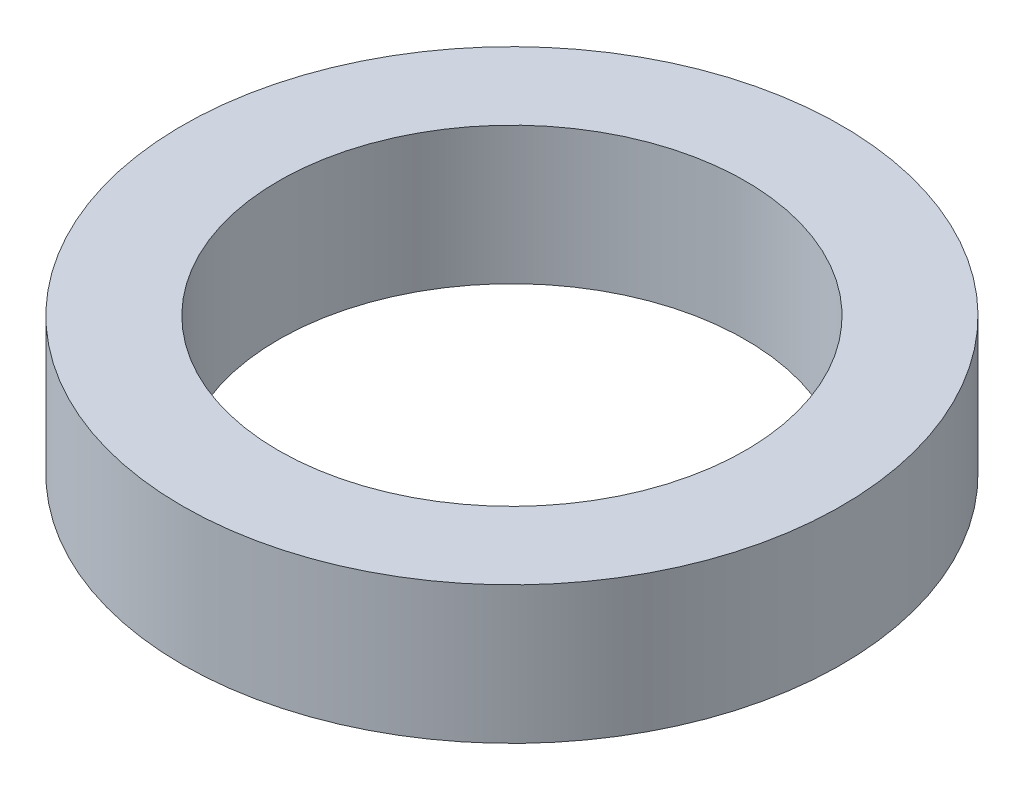
from build123d import *

# Parameters (mm, degrees)
SKETCH1_R           = 60
BOSS_EXTRUDE1_DEPTH = 25
SKETCH2_R           = 42.5
CUT_EXTRUDE1_DEPTH  = 89.459030065


with BuildPart() as part:
    # Sketch1 → Boss-Extrude1 (new body)
    with BuildSketch(Plane(origin=(0, 0, 0), x_dir=(1, 0, 0), z_dir=(0, 1, 0))):
        Circle(SKETCH1_R)
    extrude(amount=BOSS_EXTRUDE1_DEPTH)

    # Sketch2 → Cut-Extrude1 (cut, through all)
    with BuildSketch(Plane(origin=(0, 0, 0), x_dir=(1, 0, 0), z_dir=(0, 1, 0))):
        Circle(SKETCH2_R)
    extrude(amount=CUT_EXTRUDE1_DEPTH, mode=Mode.SUBTRACT)


solid = part.part
